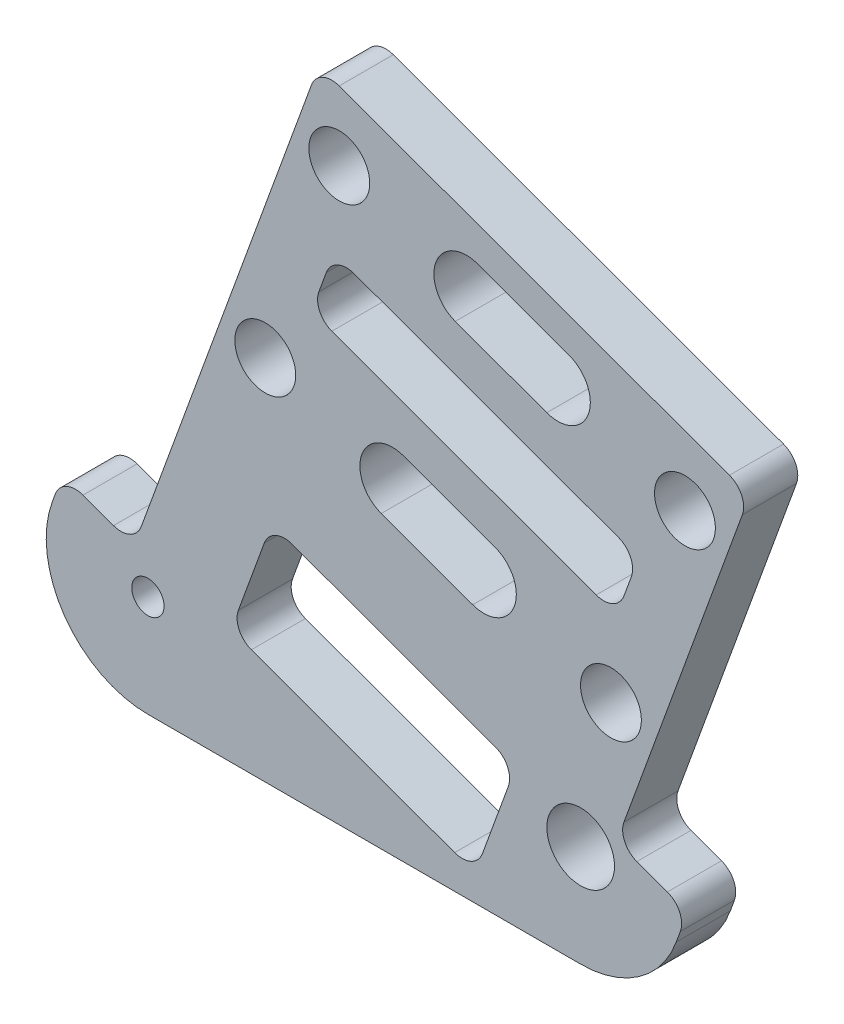
from build123d import *

# Parameters (mm, degrees)
SKETCH_1_R             = 3.96875
SKETCH_1_R_2           = 3.571875
BOSS_EXTRUDE1_DEPTH    = 6.35
FILLET1_R              = 2.54
F_10_24_TAPPED_HOLE1_D = 3.7973


with BuildPart() as part:
    # 草图1 → Boss-Extrude1 (new body)
    with BuildSketch(Plane.XY):
        with BuildLine():
            Line((-10.004213371, 7.406614284), (-11.214382662, 4.081701485))
            ThreePointArc((-11.214382662, 4.081701485), (-9.775839758, -6.845116691), (0, -11.934096761))
            Line((0, -11.934096761), (50.8, -11.934096761))
            ThreePointArc((50.8, -11.934096761), (57.645116629, -9.775839801), (62.014382214, -4.081701322))
            Line((62.014382214, -4.081701322), (63.363198014, -0.375860367))
            Line((63.363198014, -0.375860367), (55.009330616, 2.664698708))
            Line((55.009330616, 2.664698708), (70.64649272, 45.627444911))
            Line((70.64649272, 45.627444911), (20.067934728, 64.036536047))
            Line((20.067934728, 64.036536047), (-1.650345972, 4.36605521))
            Line((-1.650345972, 4.36605521), (-10.004213371, 7.406614284))
        make_face()
        Polygon((9.752383236, 1.567306626), (14.530404991, 14.694812411), (43.172235793, 4.270037674), (38.394214039, -8.85746811), align=None, mode=Mode.SUBTRACT)
        with Locations((50.8, 0)):
            Circle(SKETCH_1_R, mode=Mode.SUBTRACT)
        with BuildLine():
            ThreePointArc((27.390267642, 22.177756856), (25.113135634, 27.061082549), (29.996461326, 29.338214557))
            Line((29.996461326, 29.338214557), (40.737147877, 25.428924031))
            ThreePointArc((40.737147877, 25.428924031), (43.014279885, 20.545598338), (38.130954193, 18.26846633))
            Line((38.130954193, 18.26846633), (27.390267642, 22.177756856))
        make_face(mode=Mode.SUBTRACT)
        with Locations((54.351671245, 16.419125005)):
            Circle(SKETCH_1_R_2, mode=Mode.SUBTRACT)
        with Locations((13.775744275, 31.187555882)):
            Circle(SKETCH_1_R_2, mode=Mode.SUBTRACT)
        with Locations((22.463055915, 55.05574845)):
            Circle(SKETCH_1_R_2, mode=Mode.SUBTRACT)
        Polygon((19.203122807, 38.672691971), (21.809316491, 45.833149672), (57.611604993, 32.802181251), (55.005411309, 25.641723551), align=None, mode=Mode.SUBTRACT)
        with Locations((63.038982885, 40.287317573)):
            Circle(SKETCH_1_R_2, mode=Mode.SUBTRACT)
        with BuildLine():
            Line((46.818265834, 42.136658898), (36.077579283, 46.045949424))
            ThreePointArc((36.077579283, 46.045949424), (33.800447275, 50.929275117), (38.683772967, 53.206407125))
            Line((38.683772967, 53.206407125), (49.424459518, 49.297116599))
            ThreePointArc((49.424459518, 49.297116599), (51.701591526, 44.413790906), (46.818265834, 42.136658898))
        make_face(mode=Mode.SUBTRACT)
    extrude(amount=BOSS_EXTRUDE1_DEPTH)

    # Fillet1
    fillet1_edges = [part.edges().sort_by_distance(p)[0] for p in [
        (43.172235793, 4.270037674, 3.175),
        (38.394214039, -8.85746811, 3.175),
        (9.752383236, 1.567306626, 3.175),
        (14.530404991, 14.694812411, 3.175),
        (-1.650345972, 4.36605521, 3.175),
        (55.009330616, 2.664698708, 3.175),
        (55.005411309, 25.641723551, 3.175),
        (57.611604993, 32.802181251, 3.175),
        (19.203122807, 38.672691971, 3.175),
        (21.809316491, 45.833149672, 3.175),
        (70.64649272, 45.627444911, 3.175),
        (20.067934728, 64.036536047, 3.175),
        (-10.004213371, 7.406614284, 3.175),
        (63.363198014, -0.375860367, 3.175),
    ]]
    fillet(fillet1_edges, radius=FILLET1_R)

    # #10-24 Tapped Hole1 (through all)
    with Locations(Plane.XY.offset(6.35)):
        with Locations((0, 0)):
            Hole(F_10_24_TAPPED_HOLE1_D / 2)


solid = part.part
